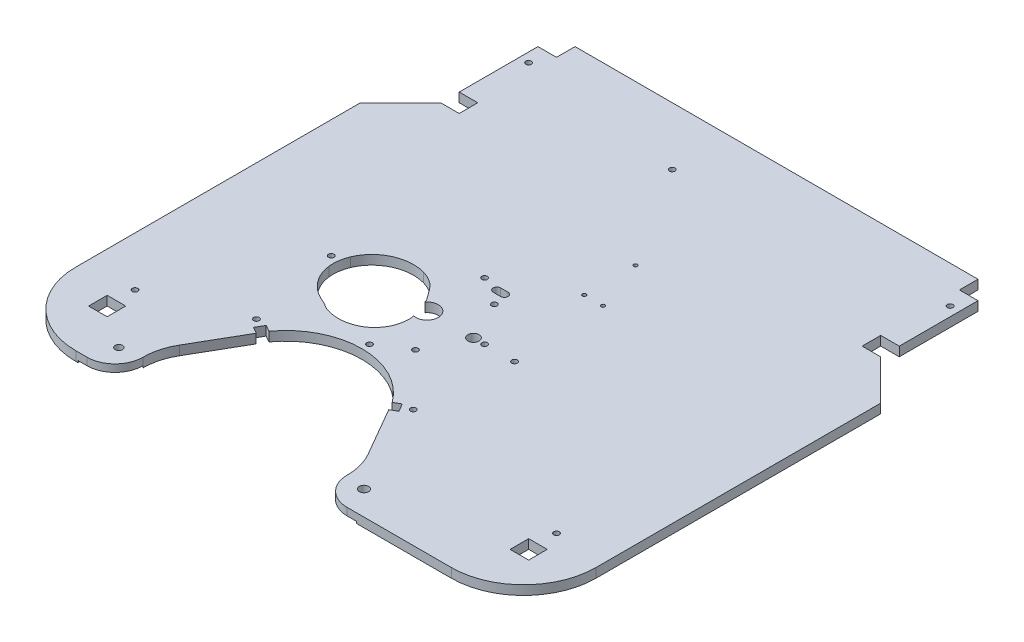
from build123d import *

# Parameters (mm, degrees)
ESQUISSE1_W              = 280.2
ESQUISSE1_H              = 276.282873123
BOSS_EXTRU_1_DEPTH       = 5
ESQUISSE2_R              = 1.5
ENL_V_MAT_EXTRU_2_DEPTH  = 283.344868376
ENL_V_MAT_EXTRU_3_DEPTH  = 283.344868376
ESQUISSE4_R              = 1
ENL_V_MAT_EXTRU_4_DEPTH  = 283.344868514
ESQUISSE5_R              = 1.5
ESQUISSE5_R_2            = 3
ENL_V_MAT_EXTRU_5_DEPTH  = 283.344868514
ESQUISSE6_R              = 6
ENL_V_MAT_EXTRU_6_DEPTH  = 283.344868514
ENL_V_MAT_EXTRU_7_DEPTH  = 283.344868514
ENL_V_MAT_EXTRU_8_DEPTH  = 283.344868514
ENL_V_MAT_EXTRU_9_DEPTH  = 283.344868514
ENL_V_MAT_EXTRU_10_DEPTH = 1
ESQUISSE11_W             = 10
ESQUISSE11_H             = 10
ENL_V_MAT_EXTRU_11_DEPTH = 283.344868514
ESQUISSE12_R             = 2.5
ESQUISSE12_R_2           = 2
ENL_V_MAT_EXTRU_12_DEPTH = 283.344868514
ESQUISSE13_R             = 1.5
ENL_V_MAT_EXTRU_15_DEPTH = 283.344868514


with BuildPart() as part:
    # Esquisse1 → Boss.-Extru.1 (new body)
    with BuildSketch(Plane(origin=(0, 0, 0), x_dir=(1, 0, 0), z_dir=(0, 1, 0))):
        with Locations((0, -106.941436562)):
            Rectangle(ESQUISSE1_W, ESQUISSE1_H)
    extrude(amount=BOSS_EXTRU_1_DEPTH)

    # Esquisse2 → Enlèv. mat.-Extru.2 (cut, through all)
    with BuildSketch(Plane(origin=(0, 0, 0), x_dir=(1, 0, 0), z_dir=(0, 1, 0))):
        with Locations((-67.225778058, -181.665063509)):
            Circle(ESQUISSE2_R)
        with Locations((17.225778058, -181.665063509)):
            Circle(ESQUISSE2_R)
        with BuildLine():
            Line((-58.181549424, -184), (-61.645651039, -182))
            Line((-61.645651039, -182), (-64.145651039, -186.330127019))
            Line((-64.145651039, -186.330127019), (-60.681549424, -188.330127019))
            Line((-60.681549424, -188.330127019), (-75.853895909, -214.609402001))
            ThreePointArc((-75.853895909, -214.609402001), (-78.945508514, -222.073215083), (-80, -230.082873123))
            ThreePointArc((-80, -230.082873123), (-84.393398282, -240.68947484), (-95, -245.082873123))
            Line((-95, -245.082873123), (45, -245.082873123))
            ThreePointArc((45, -245.082873123), (34.393398282, -240.68947484), (30, -230.082873123))
            ThreePointArc((30, -230.082873123), (28.945508514, -222.073215083), (25.853895909, -214.609402001))
            Line((25.853895909, -214.609402001), (10.681549424, -188.330127019))
            Line((10.681549424, -188.330127019), (14.145651039, -186.330127019))
            Line((14.145651039, -186.330127019), (11.645651039, -182))
            Line((11.645651039, -182), (8.181549424, -184))
            ThreePointArc((8.181549424, -184), (-25, -167.082873123), (-58.181549424, -184))
        make_face()
    extrude(amount=ENL_V_MAT_EXTRU_2_DEPTH, mode=Mode.SUBTRACT)

    # Esquisse3 → Enlèv. mat.-Extru.3 (cut, through all)
    with BuildSketch(Plane(origin=(0, 5, 0), x_dir=(1, 0, 0), z_dir=(0, 1, 0))):
        with BuildLine():
            Line((-30.219849208, -127.059608278), (-26.108908992, -139.132774718))
            add(Edge.make_bspline(
                [(-26.108908992, -139.132774718), (-25.956950527, -141.563829387), (-26.223293229, -144.068039694), (-26.956586016, -146.390839699)],
                knots=[0, 0, 0, 0, 1, 1, 1, 1], degree=3))
            add(Edge.make_bspline(
                [(-26.956586016, -146.390839699), (-27.222826546, -147.234191105), (-27.88312523, -148.88925138), (-29.202853962, -151.171032895), (-30.876306211, -153.274871062), (-32.153743683, -154.471165295), (-32.834022941, -155.024433994)],
                knots=[0, 0, 0, 0, 0.25, 0.5, 0.75, 1, 1, 1, 1], degree=3))
            add(Edge.make_bspline(
                [(-32.834022941, -155.024433994), (-34.081587302, -156.039073648), (-36.874142369, -157.737451773), (-39.94558254, -158.689126504), (-41.514400633, -158.98831152)],
                knots=[0, 0, 0, 0, 0.5, 1, 1, 1, 1], degree=3))
            add(Edge.make_bspline(
                [(-41.514400633, -158.98831152), (-44.117830219, -159.48480447), (-46.861254472, -159.483236641), (-49.46544784, -158.990765567)],
                knots=[0, 0, 0, 0, 1, 1, 1, 1], degree=3))
            add(Edge.make_bspline(
                [(-49.46544784, -158.990765567), (-49.951989881, -158.898757084), (-50.920132947, -158.680457167), (-51.984284706, -158.361141736), (-52.689516881, -158.115271255), (-53.02787714, -157.990279841), (-53.41118137, -157.84363537), (-53.818530417, -157.638563211), (-54.141104483, -157.453850504), (-54.472608463, -157.253723466), (-54.801717178, -157.036844169), (-54.998319522, -156.900216701), (-55.098918511, -156.830110672)],
                knots=[0, 0, 0, 0, 0.25, 0.5, 0.5625, 0.625, 0.6875, 0.75, 0.8125, 0.875, 0.9375, 1, 1, 1, 1], degree=3))
            add(Edge.make_bspline(
                [(-55.098918511, -156.830110672), (-55.3217742, -156.674805659), (-55.80044899, -156.330817244), (-56.33720149, -156.038962163), (-57.115277657, -155.704741536), (-58.107340958, -155.283125842), (-59.421209195, -154.724809933), (-60.695178463, -154.081458137), (-61.716195871, -153.475135599), (-62.651334353, -152.865127539), (-64.306065222, -151.716905995), (-66.442405301, -149.810998743), (-68.670825307, -147.137088975), (-71.028775534, -143.199014144), (-72.049582873, -139.81170379), (-72.320706317, -137.530983991)],
                knots=[0, 0, 0, 0, 0.03125, 0.0625, 0.09375, 0.125, 0.1875, 0.25, 0.28125, 0.3125, 0.375, 0.5, 0.625, 0.75, 1, 1, 1, 1], degree=3))
            add(Edge.make_bspline(
                [(-72.320706317, -137.530983991), (-72.524001857, -135.820839872), (-72.483207545, -132.329279177), (-71.564689145, -128.979569565), (-70.912675046, -127.389633094)],
                knots=[0, 0, 0, 0, 0.5, 1, 1, 1, 1], degree=3))
            add(Edge.make_bspline(
                [(-70.912675046, -127.389633094), (-70.401010457, -126.141938922), (-69.141056656, -123.747572814), (-66.565670024, -120.533413264), (-63.48146489, -117.931153097), (-59.920786428, -115.900931683), (-56.119376489, -114.563750704), (-52.089522484, -113.899386542), (-48.038217008, -113.946598208), (-45.368489458, -114.452209203), (-44.072416993, -114.824574117)],
                knots=[0, 0, 0, 0, 0.125, 0.25, 0.375, 0.5, 0.625, 0.75, 0.875, 1, 1, 1, 1], degree=3))
            add(Edge.make_bspline(
                [(-44.072416993, -114.824574117), (-43.133455735, -115.094340073), (-41.301452244, -115.753871763), (-39.094030914, -116.938824897), (-37.472293893, -118.085855767), (-36.300624784, -119.101293754), (-35.297198074, -120.192975728), (-34.68526159, -120.940027705), (-34.38448611, -121.321088922)],
                knots=[0, 0, 0, 0, 0.25, 0.5, 0.625, 0.75, 0.875, 1, 1, 1, 1], degree=3))
            add(Edge.make_bspline(
                [(-34.38448611, -121.321088922), (-33.65376, -122.246867115), (-32.598758637, -123.685666452), (-31.241615915, -125.567984762), (-30.544252063, -126.556620952), (-30.219849208, -127.059608278)],
                knots=[0, 0, 0, 0, 0.5, 0.75, 1, 1, 1, 1], degree=3))
        make_face()
    extrude(amount=-ENL_V_MAT_EXTRU_3_DEPTH, mode=Mode.SUBTRACT)

    # Esquisse4 → Enlèv. mat.-Extru.4 (cut, through all)
    with BuildSketch(Plane(origin=(0, 5, 0), x_dir=(1, 0, 0), z_dir=(0, 1, 0))):
        with Locations((19.9, -82.15)):
            Circle(ESQUISSE4_R)
        with Locations((9.8, -82.15)):
            Circle(ESQUISSE4_R)
        with Locations((9.8, -54.55)):
            Circle(ESQUISSE4_R)
    extrude(amount=-ENL_V_MAT_EXTRU_4_DEPTH, mode=Mode.SUBTRACT)

    # Esquisse5 → Enlèv. mat.-Extru.5 (cut, through all)
    with BuildSketch(Plane(origin=(0, 5, 0), x_dir=(1, 0, 0), z_dir=(0, 1, 0))):
        with Locations((22.122359024, -132)):
            Circle(ESQUISSE5_R)
        with Locations((-10.050791121, -153.25)):
            Circle(ESQUISSE5_R)
        with Locations((-25, -163)):
            Circle(ESQUISSE5_R)
        with Locations((-10.050791121, -110.75)):
            Circle(ESQUISSE5_R)
        with Locations((-25, -101)):
            Circle(ESQUISSE5_R)
        with Locations((-76.6, -132)):
            Circle(ESQUISSE5_R)
        with Locations((6, -132)):
            Circle(ESQUISSE5_R)
        with Locations((0, -132)):
            Circle(ESQUISSE5_R_2)
    extrude(amount=-ENL_V_MAT_EXTRU_5_DEPTH, mode=Mode.SUBTRACT)

    # Esquisse6 → Enlèv. mat.-Extru.6 (cut, through all)
    with BuildSketch(Plane(origin=(0, 5, 0), x_dir=(1, 0, 0), z_dir=(0, 1, 0))):
        with Locations((-25, -132)):
            Circle(ESQUISSE6_R)
    extrude(amount=-ENL_V_MAT_EXTRU_6_DEPTH, mode=Mode.SUBTRACT)

    # Esquisse7 → Enlèv. mat.-Extru.7 (cut, through all)
    with BuildSketch(Plane(origin=(0, 5, 0), x_dir=(1, 0, 0), z_dir=(0, 1, 0))):
        with BuildLine():
            Line((-16, -101.4), (-12, -101.4))
            ThreePointArc((-12, -101.4), (-10, -103.4), (-12, -105.4))
            Line((-12, -105.4), (-16, -105.4))
            ThreePointArc((-16, -105.4), (-18, -103.4), (-16, -101.4))
        make_face()
    extrude(amount=-ENL_V_MAT_EXTRU_7_DEPTH, mode=Mode.SUBTRACT)

    # Esquisse8 → Enlèv. mat.-Extru.8 (cut, through all)
    with BuildSketch(Plane(origin=(0, 5, 0), x_dir=(1, 0, 0), z_dir=(0, 1, 0))):
        with BuildLine():
            Line((101.1, -245.082873123), (140.1, -245.082873123))
            Line((140.1, -245.082873123), (140.1, -206.082873123))
            ThreePointArc((140.1, -206.082873123), (128.677164466, -233.660037589), (101.1, -245.082873123))
        make_face()
        with BuildLine():
            Line((-140.1, -245.082873123), (-140.1, -206.082873123))
            ThreePointArc((-140.1, -206.082873123), (-128.677164466, -233.660037589), (-101.1, -245.082873123))
            Line((-101.1, -245.082873123), (-140.1, -245.082873123))
        make_face()
    extrude(amount=-ENL_V_MAT_EXTRU_8_DEPTH, mode=Mode.SUBTRACT)

    # Esquisse9 → Enlèv. mat.-Extru.9 (cut, through all)
    with BuildSketch(Plane(origin=(0, 5, 0), x_dir=(1, 0, 0), z_dir=(0, 1, 0))):
        Polygon((-108.5, 21.2), (-118.5, 21.2), (-118.5, -21.2), (-108.5, -21.2), (-108.5, -31.2), (-118.5, -31.2), (-140.1, -52.8), (-140.1, 31.2), (-108.5, 31.2), align=None)
        Polygon((140.1, 31.2), (108.5, 31.2), (108.5, 21.2), (118.5, 21.2), (118.5, -21.2), (108.5, -21.2), (108.5, -31.2), (118.5, -31.2), (140.1, -52.8), align=None)
    extrude(amount=-ENL_V_MAT_EXTRU_9_DEPTH, mode=Mode.SUBTRACT)

    # Esquisse10 → Enlèv. mat.-Extru.10 (cut)
    with BuildSketch(Plane.XZ):
        with BuildLine():
            Line((50, 242.082873123), (50, 245.082873123))
            Line((50, 245.082873123), (45, 245.082873123))
            ThreePointArc((45, 245.082873123), (30.714652713, 234.657679446), (36.286307054, 217.873386842))
            ThreePointArc((36.286307054, 217.873386842), (75.473609251, 99.823862194), (-25, 26.5))
            ThreePointArc((-25, 26.5), (-125.473609251, 99.823862194), (-86.286307054, 217.873386842))
            ThreePointArc((-86.286307054, 217.873386842), (-80.714652713, 234.657679446), (-95, 245.082873123))
            Line((-95, 245.082873123), (-100, 245.082873123))
            Line((-100, 245.082873123), (-100, 242.082873123))
            Line((-100, 242.082873123), (-95, 242.082873123))
            ThreePointArc((-95, 242.082873123), (-83.571722171, 233.742718181), (-88.029045643, 220.315284098))
            ThreePointArc((-88.029045643, 220.315284098), (-128.330678708, 98.90890093), (-25, 23.5))
            ThreePointArc((-25, 23.5), (78.330678708, 98.90890093), (38.029045643, 220.315284098))
            ThreePointArc((38.029045643, 220.315284098), (33.571722171, 233.742718181), (45, 242.082873123))
            Line((45, 242.082873123), (50, 242.082873123))
        make_face()
    extrude(amount=-ENL_V_MAT_EXTRU_10_DEPTH, mode=Mode.SUBTRACT)

    # Esquisse11 → Enlèv. mat.-Extru.11 (cut, through all)
    with BuildSketch(Plane(origin=(0, 5, 0), x_dir=(1, 0, 0), z_dir=(0, 1, 0))):
        with Locations((-113.5, -215.8)):
            Rectangle(ESQUISSE11_W, ESQUISSE11_H)
        with Locations((113.5, -215.8)):
            Rectangle(ESQUISSE11_W, ESQUISSE11_H)
    extrude(amount=-ENL_V_MAT_EXTRU_11_DEPTH, mode=Mode.SUBTRACT)

    # Esquisse12 → Enlèv. mat.-Extru.12 (cut, through all)
    with BuildSketch(Plane(origin=(0, 5, 0), x_dir=(1, 0, 0), z_dir=(0, 1, 0))):
        with Locations((41, -232)):
            Circle(ESQUISSE12_R)
        with Locations((-91, -232)):
            Circle(ESQUISSE12_R_2)
    extrude(amount=-ENL_V_MAT_EXTRU_12_DEPTH, mode=Mode.SUBTRACT)

    # Esquisse13 → Enlèv. mat.-Extru.15 (cut, through all)
    with BuildSketch(Plane(origin=(0, 5, 0), x_dir=(1, 0, 0), z_dir=(0, 1, 0))):
        with Locations((-113.5, -200.8)):
            Circle(ESQUISSE13_R)
        with Locations((-113.5, 11.2)):
            Circle(ESQUISSE13_R)
        with Locations((113.5, 11.2)):
            Circle(ESQUISSE13_R)
        with Locations((113.5, -200.8)):
            Circle(ESQUISSE13_R)
        with Locations((-25, 0)):
            Circle(ESQUISSE13_R)
    extrude(amount=-ENL_V_MAT_EXTRU_15_DEPTH, mode=Mode.SUBTRACT)


solid = part.part
